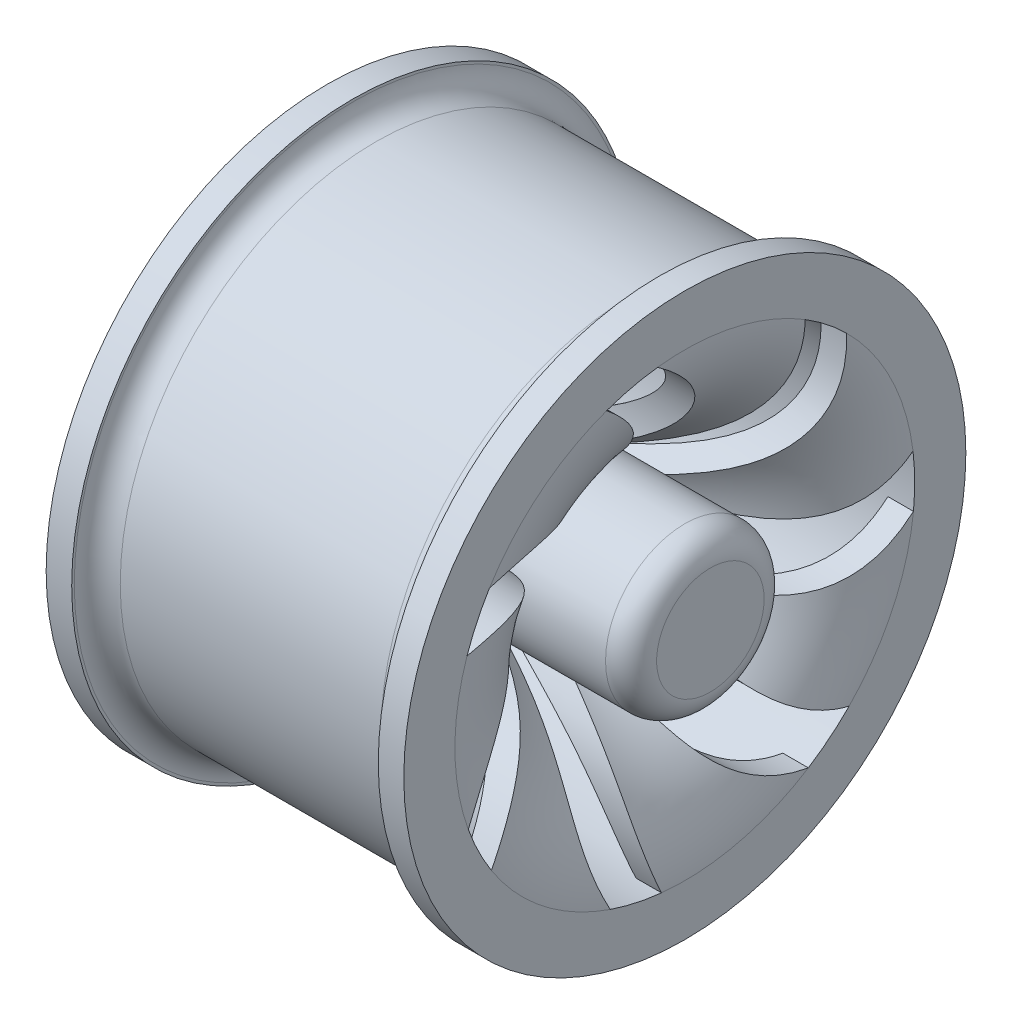
from build123d import *

# Parameters (mm, degrees)
SKETCH2_R           = 78.836919497
SKETCH2_R_2         = 50.8
BOSS_EXTRUDE1_DEPTH = 330.2
SKETCH3_R           = 78.836919497
BOSS_EXTRUDE2_DEPTH = 50.8
CUT_EXTRUDE2_DEPTH  = 532.582618226
CIRPATTERN1_COUNT   = 7
FILLET1_R           = 25.4


with BuildPart() as part:
    # Sketch1 → Revolve1 (revolve)
    with BuildSketch(Plane.XY, mode=Mode.PRIVATE) as revolve1_sk:
        with BuildLine():
            Line((-177.8, 228.6), (152.4, 228.6))
            add(Edge.make_bspline(
                [(152.4, 228.6), (152.4, 227.345627973), (152.356618236, 224.816561744), (152.102129421, 219.92540824), (151.479837767, 213.997190824), (150.274603455, 207.181741355), (148.085159139, 198.432576581), (144.298643779, 188.050568241), (138.155668163, 176.263315658), (130.469865589, 165.026237205), (118.277644561, 150.715876351), (99.686703345, 134.082203846), (77.827794121, 119.194539614), (59.253117846, 108.299117564), (45.000731093, 100.605808475), (30.647051675, 93.355320982), (18.780334622, 87.644113202), (9.447298914, 83.246297109), (4.268204726, 80.827051789), (1.138137931, 79.36750575), (0.282549718, 78.968638075), (0, 78.836919497)],
                knots=[0, 0, 0, 0, 0.015625, 0.03125, 0.0625, 0.09375, 0.125, 0.1875, 0.25, 0.3125, 0.375, 0.5, 0.625, 0.6875, 0.75, 0.8125, 0.875, 0.90625, 0.9375, 0.945407363, 0.949313613, 0.949313613, 0.949313613, 0.949313613], degree=3))
            Line((0, 78.836919497), (0, 50.8))
            add(Edge.make_bspline(
                [(177.8, 228.6), (177.8, 128.858533121), (68.653931619, 83.063840483), (0, 50.8)],
                knots=[0, 0, 0, 0, 1, 1, 1, 1], degree=3))
            Line((177.8, 228.6), (177.8, 279.4))
            Line((177.8, 279.4), (152.4, 279.4))
            Line((152.4, 279.4), (152.4, 276.86))
            ThreePointArc((152.4, 276.86), (145.704461018, 260.695538982), (129.54, 254))
            Line((129.54, 254), (-129.54, 254))
            ThreePointArc((-129.54, 254), (-145.704461018, 260.695538982), (-152.4, 276.86))
            Line((-152.4, 276.86), (-152.4, 279.4))
            Line((-152.4, 279.4), (-177.8, 279.4))
            Line((-177.8, 279.4), (-177.8, 228.6))
        make_face()
    revolve(revolve1_sk.sketch.rotate(Axis((0, 0, 0), (1, 0, 0)), 90), axis=Axis((0, 0, 0), (1, 0, 0)))

    # Sketch2 → Boss-Extrude1 (add)
    with BuildSketch(Plane.ZY.offset(177.8)):
        Circle(SKETCH2_R)
        Circle(SKETCH2_R_2, mode=Mode.SUBTRACT)
    extrude(amount=-BOSS_EXTRUDE1_DEPTH)

    # Sketch3 → Boss-Extrude2 (add)
    with BuildSketch(Plane(origin=(152.4, 0, 0), x_dir=(0, 0, -1), z_dir=(1, 0, 0))):
        with Locations(Location((0, 0, 0), (0, 0, 180))):
            Circle(SKETCH3_R)
    extrude(amount=BOSS_EXTRUDE2_DEPTH)

    # Sketch4 → Cut-Extrude2 (cut, through all)
    with BuildSketch(Plane(origin=(177.8, 0, 0), x_dir=(0, 0, -1), z_dir=(1, 0, 0))):
        with BuildLine():
            ThreePointArc((27.806081918, 73.770466205), (0, 78.836919497), (-27.806081918, 73.770466205))
            add(Edge.make_bspline(
                [(-77.790284741, 214.957278546), (-7.895977676, 157.828671756), (-27.806081918, 73.770466205)],
                knots=[0, 0, 0, 1, 1, 1], degree=2))
            ThreePointArc((-77.790284741, 214.957278546), (-52.735236292, 222.434158468), (-26.990284741, 227.001067243))
            add(Edge.make_bspline(
                [(27.806081918, 73.770466205), (55.70668991, 167.956025676), (-26.990284741, 227.001067243)],
                knots=[0, 0, 0, 1, 1, 1], degree=2))
        make_face()
    cut_extrude2 = extrude(amount=-CUT_EXTRUDE2_DEPTH, mode=Mode.SUBTRACT)

    # CirPattern1: Cut-Extrude2 ×7 about axis
    cirpattern1_axis = Axis((0, 0, 0), (1, 0, 0))
    for i in range(1, CIRPATTERN1_COUNT):
        add(cut_extrude2.rotate(cirpattern1_axis, i * 360 / CIRPATTERN1_COUNT), mode=Mode.SUBTRACT)

    # Fillet1
    fillet1_edges = [part.edges().sort_by_distance(p)[0] for p in [
        (203.2, 0, -78.836919497),
    ]]
    fillet(fillet1_edges, radius=FILLET1_R - 0.0001)  # a hair under: the kernel refuses the full size


solid = part.part
